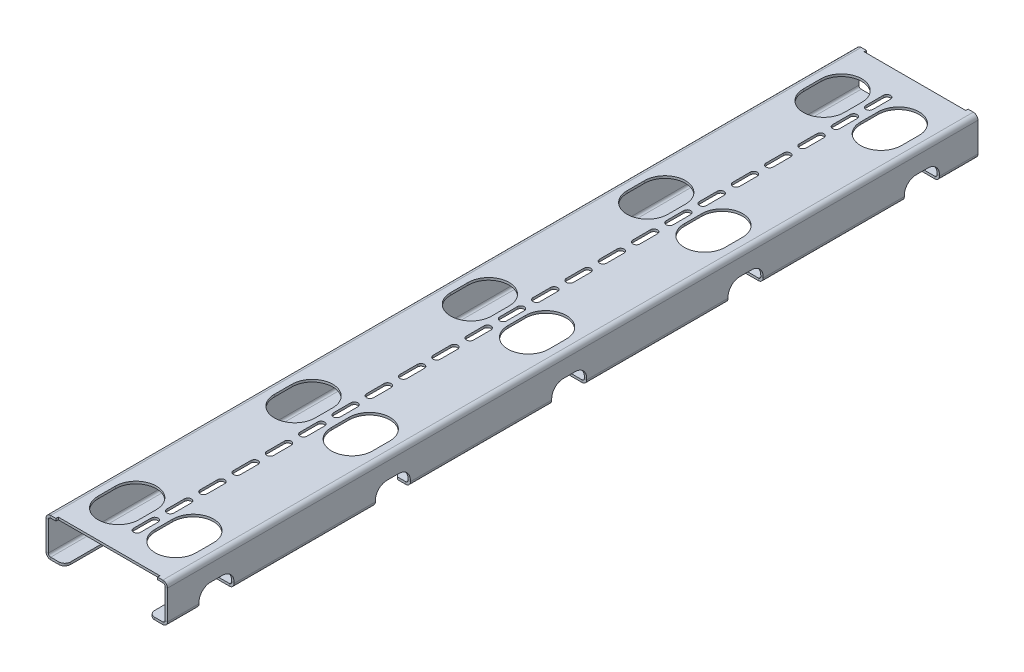
from build123d import *

# Parameters (mm, degrees)
BASE_FLANGE1_DEPTH             = 347
SKETCH4_W                      = 87
SKETCH4_H                      = 2
CUT_EXTRUDE1_DEPTH             = 10
CUT_EXTRUDE2_DEPTH             = 10
LPATTERN5_COUNT                = 12
LPATTERN5_PITCH                = 28.5
LPATTERN5_COL_COUNT            = 12
LPATTERN5_COL_PITCH            = 28.5
CUT_EXTRUDE3_DEPTH             = 10
CUT_EXTRUDE4_REACH             = 365.75
CUT_EXTRUDE4_DIRECTION_2_DEPTH = 364.749914089
LPATTERN3_COUNT                = 5
LPATTERN3_PITCH                = 151
SKETCH8_R                      = 2.5
CUT_EXTRUDE5_DEPTH             = 10
LPATTERN4_COUNT                = 2
LPATTERN4_PITCH                = 424
FILLET1_R                      = 5
BREAK_CORNER1_START            = -33
BREAK_CORNER1_DEPTH            = 2


# Read off the part's stored shape, not the designer's step: Break-Corner1
# Sheet-metal steps are written as plain solids
with BuildPart() as part:
    # Sketch3 → Base-Flange1 (new, symmetric)
    with BuildSketch(Plane.XY):
        with BuildLine():
            Line((36, -33), (48, -33))
            ThreePointArc((48, -33), (50.828427125, -31.828427125), (52, -29))
            Line((52, -29), (52, -4))
            ThreePointArc((52, -4), (50.828427125, -1.171572875), (48, 0))
            Line((48, 0), (-48, 0))
            ThreePointArc((-48, 0), (-50.828427125, -1.171572875), (-52, -4))
            Line((-52, -4), (-52, -29))
            ThreePointArc((-52, -29), (-50.828427125, -31.828427125), (-48, -33))
            Line((-48, -33), (-36, -33))
            Line((-36, -33), (-36, -31))
            Line((-36, -31), (-48, -31))
            ThreePointArc((-48, -31), (-49.414213562, -30.414213562), (-50, -29))
            Line((-50, -29), (-50, -4))
            ThreePointArc((-50, -4), (-49.414213562, -2.585786438), (-48, -2))
            Line((-48, -2), (48, -2))
            ThreePointArc((48, -2), (49.414213562, -2.585786438), (50, -4))
            Line((50, -4), (50, -29))
            ThreePointArc((50, -29), (49.414213562, -30.414213562), (48, -31))
            Line((48, -31), (36, -31))
            Line((36, -31), (36, -33))
        make_face()
    extrude(amount=BASE_FLANGE1_DEPTH, both=True)

    # Sketch4 → Cut-Extrude1 (cut)
    with BuildSketch(Plane(origin=(0, 0, 0), x_dir=(1, 0, 0), z_dir=(0, 1, 0))):
        with Locations((0, -346)):
            Rectangle(SKETCH4_W, SKETCH4_H)
        with Locations((0, 346)):
            Rectangle(SKETCH4_W, SKETCH4_H)
    extrude(amount=-CUT_EXTRUDE1_DEPTH, mode=Mode.SUBTRACT)

    # Sketch5 → Cut-Extrude2 (cut)
    with BuildSketch(Plane(origin=(0, 0, 0), x_dir=(1, 0, 0), z_dir=(0, 1, 0))):
        with BuildLine():
            Line((-3, -7.5), (-3, 7.5))
            ThreePointArc((-3, 7.5), (0, 10.5), (3, 7.5))
            Line((3, 7.5), (3, -7.5))
            ThreePointArc((3, -7.5), (0, -10.5), (-3, -7.5))
        make_face()
    cut_extrude2 = extrude(amount=-CUT_EXTRUDE2_DEPTH, mode=Mode.SUBTRACT)

    # LPattern5: Cut-Extrude2 ×12
    with Locations(*[(0, 0, i * LPATTERN5_PITCH) for i in range(1, LPATTERN5_COUNT)]):
        add(cut_extrude2, mode=Mode.SUBTRACT)

    # LPattern5 col: Cut-Extrude2 ×12
    with Locations(*[(0, 0, -i * LPATTERN5_COL_PITCH) for i in range(1, LPATTERN5_COL_COUNT)]):
        add(cut_extrude2, mode=Mode.SUBTRACT)

    # Sketch6 → Cut-Extrude3 (cut)
    with BuildSketch(Plane(origin=(0, 0, 0), x_dir=(1, 0, 0), z_dir=(0, 1, 0))):
        with BuildLine():
            Line((42, 306.5), (42, 291.5))
            ThreePointArc((42, 291.5), (24.5, 274), (7, 291.5))
            Line((7, 291.5), (7, 306.5))
            ThreePointArc((7, 306.5), (24.5, 324), (42, 306.5))
        make_face()
        with BuildLine():
            Line((-42, 306.5), (-42, 291.5))
            ThreePointArc((-42, 291.5), (-24.5, 274), (-7, 291.5))
            Line((-7, 291.5), (-7, 306.5))
            ThreePointArc((-7, 306.5), (-24.5, 324), (-42, 306.5))
        make_face()
    cut_extrude3 = extrude(amount=-CUT_EXTRUDE3_DEPTH, mode=Mode.SUBTRACT)

    # Sketch7 → Cut-Extrude4 (cut, up to next)
    with BuildSketch(Plane.ZY.offset(-52), mode=Mode.PRIVATE) as cut_extrude4_sk1:
        with BuildLine():
            Line((-314, -33), (-284, -33))
            Line((-284, -33), (-284, -28))
            ThreePointArc((-284, -28), (-286.928932188, -20.928932188), (-294, -18))
            Line((-294, -18), (-304, -18))
            ThreePointArc((-304, -18), (-311.071067812, -20.928932188), (-314, -28))
            Line((-314, -28), (-314, -33))
        make_face()
    cut_extrude4_tool1 = extrude(cut_extrude4_sk1.sketch, amount=CUT_EXTRUDE4_REACH, mode=Mode.PRIVATE) & part.part
    cut_extrude4 = cut_extrude4_tool1.solids().sort_by_distance((52, -26.055254, -299))[0]
    add(cut_extrude4, mode=Mode.SUBTRACT)

    # Sketch7 → Cut-Extrude4 direction 2 (cut)
    with BuildSketch(Plane.ZY.offset(-52)):
        with BuildLine():
            Line((-314, -33), (-284, -33))
            Line((-284, -33), (-284, -28))
            ThreePointArc((-284, -28), (-286.928932188, -20.928932188), (-294, -18))
            Line((-294, -18), (-304, -18))
            ThreePointArc((-304, -18), (-311.071067812, -20.928932188), (-314, -28))
            Line((-314, -28), (-314, -33))
        make_face()
    cut_extrude4_direction_2 = extrude(amount=-CUT_EXTRUDE4_DIRECTION_2_DEPTH, mode=Mode.SUBTRACT)

    # LPattern3: Cut-Extrude3, Cut-Extrude4, Cut-Extrude4 direction 2 ×5
    with Locations(*[(0, 0, i * LPATTERN3_PITCH) for i in range(1, LPATTERN3_COUNT)]):
        add(cut_extrude3, mode=Mode.SUBTRACT)
        add(cut_extrude4, mode=Mode.SUBTRACT)
        add(cut_extrude4_direction_2, mode=Mode.SUBTRACT)

    # Sketch8 → Cut-Extrude5 (cut)
    with BuildSketch(Plane.ZY.offset(52)):
        with Locations(Location((-247, -9, 0), (0, 0, 270))):
            Circle(SKETCH8_R)
        with Locations(Location((-177, -9, 0), (0, 0, 270))):
            Circle(SKETCH8_R)
    cut_extrude5 = extrude(amount=-CUT_EXTRUDE5_DEPTH, mode=Mode.SUBTRACT)

    # LPattern4: Cut-Extrude5 ×2
    with Locations(*[(0, 0, i * LPATTERN4_PITCH) for i in range(1, LPATTERN4_COUNT)]):
        add(cut_extrude5, mode=Mode.SUBTRACT)

    # Fillet1
    fillet1_edges = [part.edges().sort_by_distance(p)[0] for p in [
        (-36, -32, -347),
        (36, -32, -347),
        (-36, -32, 347),
        (36, -32, 347),
    ]]
    fillet(fillet1_edges, radius=FILLET1_R)

    # Break-Corner1 outline → Break-Corner1 (cut)
    with BuildSketch(Plane(origin=(0, 0, 0), x_dir=(1, 0, 0), z_dir=(0, 1, 0)).offset(BREAK_CORNER1_START)):
        Polygon((41, -139), (36, -134), (36, -139), align=None)
        Polygon((36, 279), (41, 284), (36, 284), align=None)
    extrude(amount=BREAK_CORNER1_DEPTH, mode=Mode.SUBTRACT)


solid = part.part
